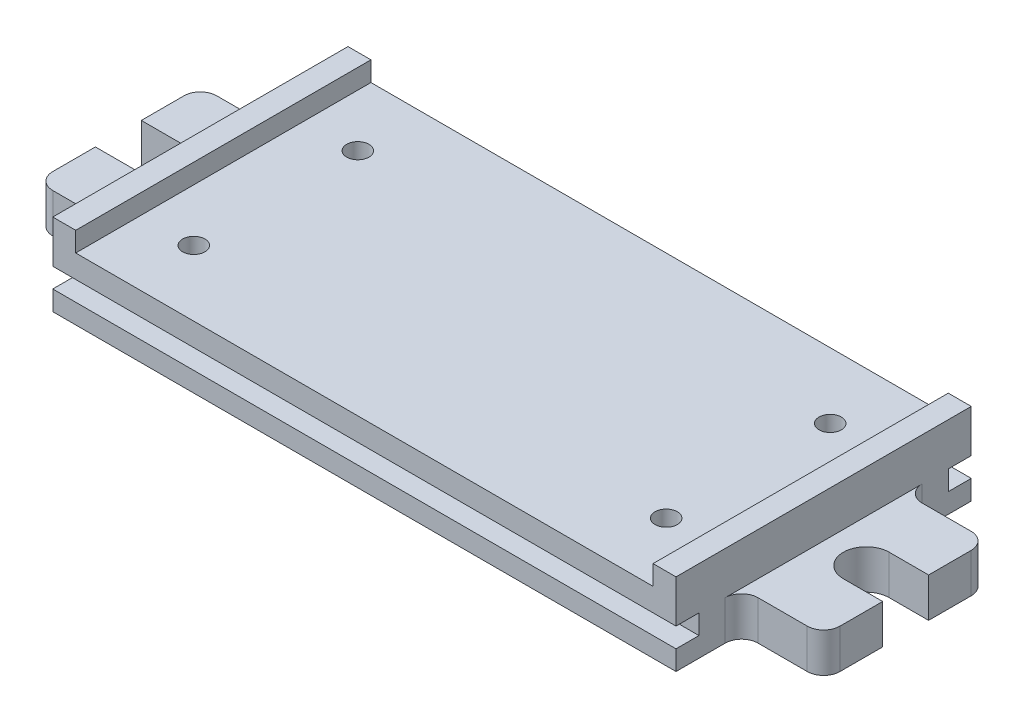
from build123d import *

# Parameters (mm, degrees)
SKETCH1_W               = 7
SKETCH1_H               = 90
BOSS_EXTRUDE2_DEPTH     = 25
BOSS_EXTRUDE2_2_DEPTH   = 25
SKETCH1_4_W             = 176
SKETCH1_4_H             = 90
BOSS_EXTRUDE3_DEPTH     = 19
BOSS_EXTRUDE4_DEPTH     = 12
FILLET2_R               = 5
CUT_EXTRUDE3_DEPTH      = 6
CUT_EXTRUDE4_DEPTH      = 222.076909694
CUT_EXTRUDE4_DEPTH_BACK = 222.076909694
SKETCH7_W               = 7
SKETCH7_H               = 6
M8_TAPPED_HOLE1_D       = 6.8


with BuildPart() as part:
    # Sketch1 → Boss-Extrude2 (new body)
    with BuildSketch(Plane(origin=(0, 0, 0), x_dir=(1, 0, 0), z_dir=(0, 1, 0))):
        with Locations((-91.5, 0)):
            Rectangle(SKETCH1_W, SKETCH1_H)
    extrude(amount=BOSS_EXTRUDE2_DEPTH)



with BuildPart() as body_2:
    # Sketch1 → Boss-Extrude2 2 (new body)
    with BuildSketch(Plane(origin=(0, 0, 0), x_dir=(1, 0, 0), z_dir=(0, 1, 0))):
        with Locations((91.5, 0)):
            Rectangle(SKETCH1_W, SKETCH1_H)
    extrude(amount=BOSS_EXTRUDE2_2_DEPTH)


with BuildPart() as part_1:
    add(part.part)

    add(body_2.part)  # Boss-Extrude3 merges body 2
    # Sketch1<4> → Boss-Extrude3 (add)
    with BuildSketch(Plane(origin=(0, 0, 0), x_dir=(1, 0, 0), z_dir=(0, 1, 0))):
        Rectangle(SKETCH1_4_W, SKETCH1_4_H)
    extrude(amount=BOSS_EXTRUDE3_DEPTH)

    # Sketch1<5> → Boss-Extrude4 (add)
    with BuildSketch(Plane(origin=(0, 0, 0), x_dir=(1, 0, 0), z_dir=(0, 1, 0))):
        with BuildLine():
            Line((-95, -25), (-95, 25))
            Line((-95, 25), (-115, 25))
            ThreePointArc((-115, 25), (-118.535533906, 23.535533906), (-120, 20))
            Line((-120, 20), (-120, 7))
            Line((-120, 7), (-108, 7))
            ThreePointArc((-108, 7), (-101, 0), (-108, -7))
            Line((-108, -7), (-120, -7))
            Line((-120, -7), (-120, -20))
            ThreePointArc((-120, -20), (-118.535533906, -23.535533906), (-115, -25))
            Line((-115, -25), (-95, -25))
        make_face()
        with BuildLine():
            Line((115, 25), (95, 25))
            Line((95, 25), (95, -25))
            Line((95, -25), (115, -25))
            ThreePointArc((115, -25), (118.535533906, -23.535533906), (120, -20))
            Line((120, -20), (120, -7))
            Line((120, -7), (108, -7))
            ThreePointArc((108, -7), (101, 0), (108, 7))
            Line((108, 7), (120, 7))
            Line((120, 7), (120, 20))
            ThreePointArc((120, 20), (118.535533906, 23.535533906), (115, 25))
        make_face()
    extrude(amount=BOSS_EXTRUDE4_DEPTH)

    # Fillet2
    fillet2_edges = [part_1.edges().sort_by_distance(p)[0] for p in [
        (95, 6, 25),
        (95, 6, -25),
        (-95, 6, -25),
        (-95, 6, 25),
    ]]
    fillet(fillet2_edges, radius=FILLET2_R)

    # Sketch1<6> → Cut-Extrude3 (cut)
    with BuildSketch(Plane(origin=(0, 0, 0), x_dir=(1, 0, 0), z_dir=(0, 1, 0))):
        with BuildLine():
            ThreePointArc((-82, -25), (-80.535533906, -28.535533906), (-77, -30))
            Line((-77, -30), (77, -30))
            ThreePointArc((77, -30), (80.535533906, -28.535533906), (82, -25))
            Line((82, -25), (82, 25))
            ThreePointArc((82, 25), (80.535533906, 28.535533906), (77, 30))
            Line((77, 30), (-77, 30))
            ThreePointArc((-77, 30), (-80.535533906, 28.535533906), (-82, 25))
            Line((-82, 25), (-82, -25))
        make_face()
    extrude(amount=CUT_EXTRUDE3_DEPTH, mode=Mode.SUBTRACT)

    # Sketch7 → Cut-Extrude4 (cut, two sides: drawn at the far end of the back side and taken through both)
    with BuildSketch(Plane.ZY.offset(95).offset(-CUT_EXTRUDE4_DEPTH_BACK)):
        with Locations((41.5, 9)):
            Rectangle(SKETCH7_W, SKETCH7_H)
        with Locations((-41.5, 9)):
            Rectangle(SKETCH7_W, SKETCH7_H)
    extrude(amount=CUT_EXTRUDE4_DEPTH + CUT_EXTRUDE4_DEPTH_BACK, mode=Mode.SUBTRACT)

    # M8 Tapped Hole1 (through all)
    with Locations(Plane(origin=(0, 19, 0), x_dir=(1, 0, 0), z_dir=(0, 1, 0))):
        with Locations((-72, 25), (72, 25), (72, -25), (-72, -25)):
            Hole(M8_TAPPED_HOLE1_D / 2)


solid = part_1.part
